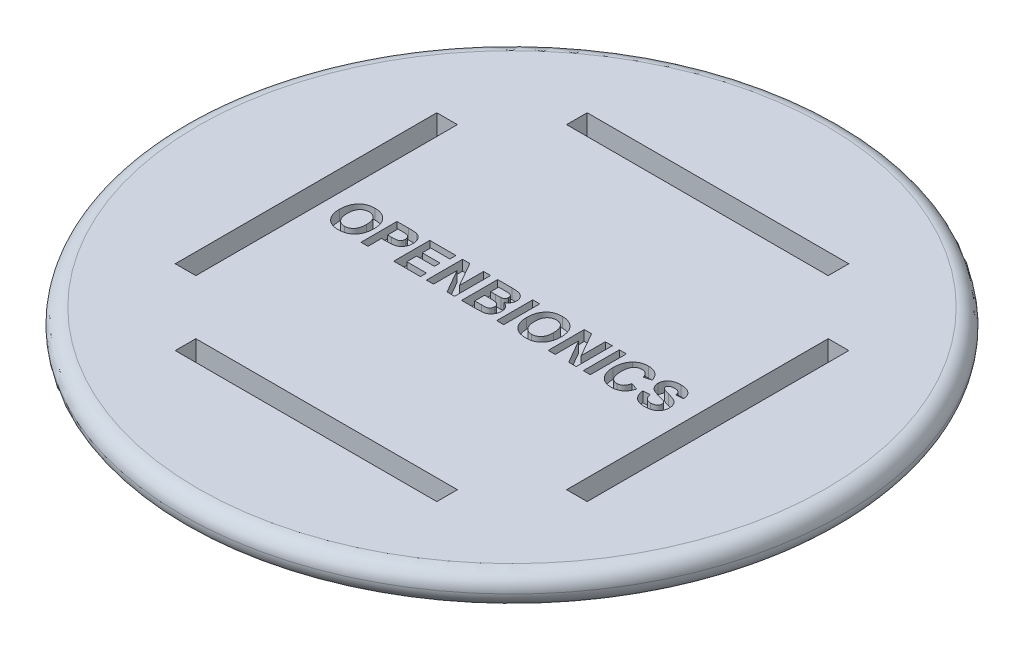
from build123d import *

# Parameters (mm, degrees)
SKETCH1_R           = 32
BOSS_EXTRUDE1_DEPTH = 3
FILLET1_R           = 1.5
SKETCH2_W           = 0.681818182
SKETCH2_H           = 3.5
CUT_EXTRUDE16_DEPTH = 1


with BuildPart() as part:
    # Sketch1 → Boss-Extrude1 (new body)
    with BuildSketch(Plane(origin=(0, 0, 0), x_dir=(1, 0, 0), z_dir=(0, 1, 0))):
        with Locations(Location((0, 0, 0), (0, 0, 270))):
            Circle(SKETCH1_R)
        Polygon((20, 0), (20, -12.7), (18, -12.7), (18, 0), (18, 12.7), (20, 12.7), align=None, mode=Mode.SUBTRACT)
        Polygon((0, -20), (12.7, -20), (12.7, -18), (-12.7, -18), (-12.7, -20), align=None, mode=Mode.SUBTRACT)
        Polygon((-12.7, 20), (0, 20), (12.7, 20), (12.7, 18), (-12.7, 18), align=None, mode=Mode.SUBTRACT)
        Polygon((-18, 0), (-18, 12.7), (-20, 12.7), (-20, -12.7), (-18, -12.7), align=None, mode=Mode.SUBTRACT)
    extrude(amount=BOSS_EXTRUDE1_DEPTH)

    # Fillet1
    fillet1_edges = [part.edges().sort_by_distance(p)[0] for p in [
        (0, 0, -32),
        (0, 3, -32),
    ]]
    fillet(fillet1_edges, radius=FILLET1_R - 0.0001)  # a hair under: the kernel refuses the full size

    # Sketch2 → Cut-Extrude16 (cut)
    # profile 1 of 11: a face of its own
    with BuildSketch(Plane(origin=(0, 3, 0), x_dir=(1, 0, 0), z_dir=(0, 1, 0))):
        with BuildLine():
            add(Edge.make_bspline(
                [(-16.609645699, -0.147233293), (-16.608905442, -0.096557718), (-16.607458053, 0.002525829), (-16.597871271, 0.14770248), (-16.579789771, 0.285848282), (-16.555875636, 0.4172445), (-16.525617713, 0.541945853), (-16.487813812, 0.659647477), (-16.44331312, 0.770682466), (-16.391155277, 0.874620577), (-16.333301907, 0.971543838), (-16.272697263, 1.063159211), (-16.205953939, 1.147073138), (-16.13585696, 1.225232361), (-16.061728351, 1.297289554), (-15.983608008, 1.363234515), (-15.899944986, 1.42097439), (-15.813127545, 1.474277192), (-15.72129319, 1.520264746), (-15.62484703, 1.56012091), (-15.524058793, 1.594220167), (-15.418469302, 1.622021844), (-15.30806541, 1.643034191), (-15.193109273, 1.658689683), (-15.073346632, 1.668122408), (-14.992001856, 1.669053604), (-14.95055479, 1.669528071)],
                knots=[0, 0, 0, 0, 1.306822469, 2.555167917, 3.749327779, 4.897664792, 5.997815556, 7.055828301, 8.082935779, 9.0794699, 10.051102117, 10.992536892, 11.909768373, 12.813243673, 13.698297478, 14.573761109, 15.446004583, 16.317114982, 17.19898365, 18.091251206, 19.006346915, 19.940728156, 20.904561385, 21.902646417, 22.93134929, 24, 24, 24, 24], degree=3))
            add(Edge.make_bspline(
                [(-14.95055479, 1.669528071), (-14.890582564, 1.66831117), (-14.773291827, 1.665931215), (-14.601723326, 1.642966704), (-14.438589976, 1.607474787), (-14.283900163, 1.555868008), (-14.137827669, 1.489581569), (-14.000055675, 1.409150439), (-13.871255158, 1.313627239), (-13.751395843, 1.20456106), (-13.642489911, 1.082015619), (-13.5481512, 0.945726117), (-13.468334758, 0.79732096), (-13.403659805, 0.636170011), (-13.353404262, 0.462911848), (-13.317656035, 0.27748728), (-13.295025272, 0.079889433), (-13.292673468, -0.056023364), (-13.291463881, -0.125926475)],
                knots=[0, 0, 0, 0, 1.040908293, 2.035757388, 3.000252588, 3.93627331, 4.861707544, 5.781132162, 6.701209106, 7.641166776, 8.590615097, 9.541717432, 10.512900712, 11.510675978, 12.551430012, 13.640672608, 14.78654308, 16, 16, 16, 16], degree=3))
            add(Edge.make_bspline(
                [(-13.291463881, -0.125926475), (-13.292959516, -0.196535874), (-13.295878597, -0.334346616), (-13.318708686, -0.53518747), (-13.356929207, -0.724140158), (-13.409926404, -0.901358442), (-13.479110907, -1.066673975), (-13.564088439, -1.219841549), (-13.663295569, -1.362152004), (-13.741652399, -1.44616013), (-13.780810472, -1.488142384)],
                knots=[0, 0, 0, 0, 1.14004733, 2.225068784, 3.25899939, 4.249525742, 5.207352596, 6.146814289, 7.073888242, 8, 8, 8, 8], degree=3))
            add(Edge.make_bspline(
                [(-13.780810472, -1.488142384), (-13.817442716, -1.522911297), (-13.89052404, -1.592275275), (-14.014020638, -1.679958657), (-14.145821332, -1.755315884), (-14.287886244, -1.815603701), (-14.439090396, -1.863388675), (-14.600109572, -1.897279676), (-14.770840267, -1.917185032), (-14.887764501, -1.919958836), (-14.947713881, -1.92138102)],
                knots=[0, 0, 0, 0, 0.946839478, 1.888944702, 2.834083416, 3.791455867, 4.779314375, 5.805853593, 6.875017511, 8, 8, 8, 8], degree=3))
            add(Edge.make_bspline(
                [(-14.947713881, -1.92138102), (-15.008151737, -1.920369051), (-15.125850386, -1.918398308), (-15.297313928, -1.896842161), (-15.45931786, -1.864023454), (-15.611743002, -1.817339102), (-15.754363543, -1.756591298), (-15.886728679, -1.682270075), (-16.010760362, -1.595883946), (-16.083696645, -1.526981742), (-16.120299108, -1.492403748)],
                knots=[0, 0, 0, 0, 1.130604799, 2.201776614, 3.228943634, 4.221246958, 5.18008189, 6.12432893, 7.058710182, 8, 8, 8, 8], degree=3))
            add(Edge.make_bspline(
                [(-16.120299108, -1.492403748), (-16.159399545, -1.450378792), (-16.237377905, -1.366568037), (-16.337051435, -1.225606985), (-16.42200233, -1.07380512), (-16.490901903, -0.91029523), (-16.544235862, -0.735555474), (-16.58232865, -0.54963702), (-16.605250774, -0.352115688), (-16.608156404, -0.216661181), (-16.609645699, -0.147233293)],
                knots=[0, 0, 0, 0, 0.936372132, 1.867415515, 2.810529029, 3.771844382, 4.758555217, 5.788795039, 6.866635801, 8, 8, 8, 8], degree=3))
        make_face()
        with BuildLine():
            add(Edge.make_bspline(
                [(-15.882372972, -0.123795793), (-15.881641901, -0.172599695), (-15.880226747, -0.26707082), (-15.866896338, -0.403912282), (-15.847208219, -0.531656075), (-15.816982513, -0.649810306), (-15.779913059, -0.759050011), (-15.733453528, -0.858584396), (-15.67868626, -0.948847957), (-15.615139957, -1.029150985), (-15.545666147, -1.099846976), (-15.472044384, -1.16168351), (-15.394301004, -1.213604642), (-15.312927286, -1.256904823), (-15.226931579, -1.289573222), (-15.136926539, -1.312995227), (-15.042881306, -1.327553491), (-14.978779259, -1.329490358), (-14.946293426, -1.330471929)],
                knots=[0, 0, 0, 0, 1.361421762, 2.635343484, 3.833243152, 4.964401266, 6.034049828, 7.04772755, 8.023209814, 8.973424148, 9.898364399, 10.784781028, 11.651407134, 12.502433558, 13.351406345, 14.211841733, 15.09379164, 16, 16, 16, 16], degree=3))
            add(Edge.make_bspline(
                [(-14.946293426, -1.330471929), (-14.913581362, -1.329419897), (-14.84929761, -1.327352508), (-14.754891878, -1.31391941), (-14.664913303, -1.290293028), (-14.579200905, -1.25740225), (-14.497547477, -1.215610179), (-14.421451735, -1.162707275), (-14.348329639, -1.102264927), (-14.28009068, -1.031847385), (-14.218149516, -0.951611736), (-14.164542328, -0.860889656), (-14.119109364, -0.760389861), (-14.082549686, -0.64956139), (-14.05339287, -0.529167563), (-14.033178156, -0.398750556), (-14.021170678, -0.258492322), (-14.019565442, -0.16169924), (-14.018736608, -0.111721929)],
                knots=[0, 0, 0, 0, 0.908145916, 1.784632924, 2.640675726, 3.485314444, 4.328955329, 5.180267109, 6.052901625, 6.959238294, 7.896525459, 8.860238814, 9.877929898, 10.952438517, 12.095379492, 13.313121954, 14.612680409, 16, 16, 16, 16], degree=3))
            add(Edge.make_bspline(
                [(-14.018736608, -0.111721929), (-14.019561859, -0.062691067), (-14.021163172, 0.032448151), (-14.033240822, 0.170070932), (-14.05292108, 0.297781816), (-14.080141262, 0.415605543), (-14.116609514, 0.52346823), (-14.160245175, 0.621801042), (-14.212266764, 0.710334665), (-14.273190985, 0.787931911), (-14.340071496, 0.856035555), (-14.411727129, 0.915864753), (-14.488661175, 0.966415529), (-14.570536271, 1.007897656), (-14.657716609, 1.039304271), (-14.749392791, 1.061624987), (-14.846127882, 1.076749172), (-14.91237948, 1.077985902), (-14.946293426, 1.07861898)],
                knots=[0, 0, 0, 0, 1.375936073, 2.669858809, 3.873641008, 5.000148955, 6.059108832, 7.064301869, 8.014637772, 8.933034729, 9.825740232, 10.689210757, 11.547964789, 12.403732021, 13.259189679, 14.142274399, 15.049037189, 16, 16, 16, 16], degree=3))
            add(Edge.make_bspline(
                [(-14.946293426, 1.07861898), (-14.980207704, 1.07798687), (-15.04645995, 1.076752032), (-15.143190397, 1.061614283), (-15.235395077, 1.039218514), (-15.32298637, 1.007371542), (-15.405474535, 0.965542642), (-15.483251684, 0.914995555), (-15.556009462, 0.854823271), (-15.623652902, 0.785793161), (-15.685422278, 0.707209287), (-15.738620691, 0.617879791), (-15.783227634, 0.518645119), (-15.819576844, 0.40938079), (-15.847393508, 0.290212554), (-15.868024932, 0.161129742), (-15.87993733, 0.022024837), (-15.881542181, -0.074056743), (-15.882372972, -0.123795793)],
                knots=[0, 0, 0, 0, 0.942220191, 1.840646711, 2.715612845, 3.577830925, 4.425730711, 5.28209839, 6.151972775, 7.045780727, 7.964974726, 8.924626984, 9.929287112, 10.984750631, 12.121637807, 13.328386914, 14.616972206, 16, 16, 16, 16], degree=3))
        make_face(mode=Mode.SUBTRACT)
    # profile 2 of 11: a face of its own
    with BuildSketch(Plane(origin=(0, 3, 0), x_dir=(1, 0, 0), z_dir=(0, 1, 0))):
        with BuildLine():
            Line((-12.791463881, -1.875926475), (-12.791463881, 1.624073525))
            Line((-12.791463881, 1.624073525), (-11.674986608, 1.624073525))
            add(Edge.make_bspline(
                [(-11.674986608, 1.624073525), (-11.625270457, 1.623928421), (-11.530331219, 1.623651327), (-11.394651558, 1.621822544), (-11.272481968, 1.617453942), (-11.163793541, 1.611934839), (-11.068331871, 1.605005738), (-10.986394248, 1.596552324), (-10.917648534, 1.587555927), (-10.877111129, 1.57795302), (-10.858935472, 1.573647389)],
                knots=[0, 0, 0, 0, 1.456831097, 2.782002075, 3.975928354, 5.038771763, 5.970943127, 6.77995415, 7.452971009, 8, 8, 8, 8], degree=3))
            add(Edge.make_bspline(
                [(-10.858935472, 1.573647389), (-10.83396381, 1.566183483), (-10.784345205, 1.551352729), (-10.712283119, 1.523048973), (-10.643979953, 1.488004172), (-10.578994674, 1.447201832), (-10.517122794, 1.401026172), (-10.45843676, 1.348965754), (-10.404124747, 1.290483869), (-10.352637657, 1.227215844), (-10.305934495, 1.158765886), (-10.265169456, 1.085114752), (-10.230979455, 1.006624692), (-10.203495535, 0.923063697), (-10.181385626, 0.835039583), (-10.165906536, 0.742184651), (-10.156479366, 0.644631361), (-10.155566906, 0.577930698), (-10.155100245, 0.543817843)],
                knots=[0, 0, 0, 0, 0.927373544, 1.842688003, 2.750838682, 3.655582389, 4.570625339, 5.495661043, 6.443441331, 7.408001735, 8.396552612, 9.388437323, 10.39967321, 11.438816708, 12.515770506, 13.626698151, 14.786217429, 16, 16, 16, 16], degree=3))
            add(Edge.make_bspline(
                [(-10.155100245, 0.543817843), (-10.155693572, 0.512789484), (-10.156859485, 0.451817496), (-10.16460466, 0.36233939), (-10.178028121, 0.276633615), (-10.1972975, 0.19505333), (-10.22128637, 0.117018241), (-10.251435876, 0.043119255), (-10.285903991, -0.027541807), (-10.326671303, -0.09347469), (-10.371297658, -0.154818284), (-10.418445904, -0.212018639), (-10.467730605, -0.26484138), (-10.521211534, -0.311679396), (-10.575976652, -0.355443725), (-10.634916974, -0.392958139), (-10.695797985, -0.426379705), (-10.760624312, -0.455796309), (-10.832980381, -0.480171442), (-10.915567837, -0.501312008), (-11.01004225, -0.518688511), (-11.116048513, -0.532515952), (-11.233546954, -0.543762964), (-11.362619044, -0.552225525), (-11.503545927, -0.557164457), (-11.601355637, -0.557546058), (-11.652259335, -0.557744657)],
                knots=[0, 0, 0, 0, 1.041929051, 2.047432956, 3.01331119, 3.952415533, 4.860138496, 5.75180984, 6.629982677, 7.497147139, 8.351091857, 9.175590388, 9.985393555, 10.773682479, 11.560888284, 12.337098378, 13.116234203, 13.891955602, 14.724122277, 15.676657873, 16.752518699, 17.947684938, 19.265579772, 20.715612603, 22.290686436, 24, 24, 24, 24], degree=3))
            Line((-11.652259335, -0.557744657), (-12.109645699, -0.557744657))
            Line((-12.109645699, -0.557744657), (-12.109645699, -1.875926475))
            Line((-12.109645699, -1.875926475), (-12.791463881, -1.875926475))
        make_face()
        with BuildLine():
            Line((-12.109645699, 1.033164434), (-12.109645699, 0.033164434))
            Line((-12.109645699, 0.033164434), (-11.725412745, 0.033164434))
            add(Edge.make_bspline(
                [(-11.725412745, 0.033164434), (-11.694398142, 0.033288322), (-11.634965167, 0.033525727), (-11.549721025, 0.035649966), (-11.472281288, 0.039095952), (-11.402646175, 0.043976675), (-11.340796147, 0.050205331), (-11.286530592, 0.057993325), (-11.23993845, 0.066772338), (-11.188520738, 0.080945946), (-11.132070764, 0.10422609), (-11.071650781, 0.14201605), (-11.016956227, 0.187796848), (-10.969233422, 0.242714029), (-10.929968336, 0.305764881), (-10.902124247, 0.376494756), (-10.885498968, 0.453797942), (-10.883438686, 0.507511106), (-10.882372972, 0.535295116)],
                knots=[0, 0, 0, 0, 1.322620714, 2.534524919, 3.636151256, 4.628084681, 5.511128162, 6.286423077, 6.965565192, 7.531394371, 8.5588625, 9.556278385, 10.559400822, 11.589890268, 12.646170356, 13.711052099, 14.816004388, 16, 16, 16, 16], degree=3))
            add(Edge.make_bspline(
                [(-10.882372972, 0.535295116), (-10.883398372, 0.563553773), (-10.885383336, 0.618256731), (-10.902585194, 0.69692744), (-10.93208544, 0.768116165), (-10.972241735, 0.831581408), (-11.020343596, 0.886692474), (-11.074603072, 0.933098313), (-11.135354968, 0.967945758), (-11.190720168, 0.990028193), (-11.24156165, 1.003270619), (-11.28969355, 1.01038336), (-11.347003666, 1.017401792), (-11.413747128, 1.024023973), (-11.489820613, 1.027873679), (-11.575305158, 1.030505534), (-11.670239697, 1.032860162), (-11.736774716, 1.033059937), (-11.771577517, 1.033164434)],
                knots=[0, 0, 0, 0, 1.157153208, 2.240011081, 3.27962838, 4.299823827, 5.303789601, 6.267767994, 7.211266943, 8.160733058, 8.701966372, 9.360708122, 10.152542664, 11.068708535, 12.10846164, 13.27335753, 14.573761651, 16, 16, 16, 16], degree=3))
            Line((-11.771577517, 1.033164434), (-12.109645699, 1.033164434))
        make_face(mode=Mode.SUBTRACT)
    # profile 3 of 11: a face of its own
    with BuildSketch(Plane(origin=(0, 3, 0), x_dir=(1, 0, 0), z_dir=(0, 1, 0))):
        Polygon((-9.609645699, -1.875926475), (-9.609645699, 1.624073525), (-7.064191154, 1.624073525), (-7.064191154, 1.033164434), (-8.927827517, 1.033164434), (-8.927827517, 0.214982616), (-7.20055479, 0.214982616), (-7.20055479, -0.330471929), (-8.927827517, -0.330471929), (-8.927827517, -1.285017384), (-7.018736608, -1.285017384), (-7.018736608, -1.875926475), align=None)
    # profile 4 of 11: a face of its own
    with BuildSketch(Plane(origin=(0, 3, 0), x_dir=(1, 0, 0), z_dir=(0, 1, 0))):
        Polygon((-6.427827517, -1.875926475), (-6.427827517, 1.624073525), (-5.719020699, 1.624073525), (-4.382372972, -0.713284429), (-4.382372972, 1.624073525), (-3.70055479, 1.624073525), (-3.70055479, -1.875926475), (-4.431378654, -1.875926475), (-5.746009335, 0.40674398), (-5.746009335, -1.875926475), align=None)
    # profile 5 of 11: a face of its own
    with BuildSketch(Plane(origin=(0, 3, 0), x_dir=(1, 0, 0), z_dir=(0, 1, 0))):
        with BuildLine():
            Line((-3.018736608, 1.624073525), (-1.635213881, 1.624073525))
            add(Edge.make_bspline(
                [(-1.635213881, 1.624073525), (-1.589758688, 1.623729728), (-1.502385048, 1.623068883), (-1.376361734, 1.620042063), (-1.260814828, 1.612687408), (-1.155902157, 1.603571548), (-1.061427784, 1.592862669), (-0.97766271, 1.577564015), (-0.903846336, 1.561390549), (-0.820186294, 1.534716517), (-0.726043327, 1.491953202), (-0.623562838, 1.424288818), (-0.529999332, 1.340597464), (-0.46144603, 1.25874357), (-0.41238907, 1.187107345), (-0.37937461, 1.131201536), (-0.352528527, 1.072724714), (-0.330663143, 1.012767022), (-0.31222324, 0.951527668), (-0.300838053, 0.887879502), (-0.292259279, 0.822696555), (-0.291730329, 0.778459369), (-0.291463881, 0.756175798)],
                knots=[0, 0, 0, 0, 1.49832573, 2.880070805, 4.154409333, 5.313752829, 6.351335186, 7.286599284, 8.119477371, 8.840095269, 10.177568719, 11.512946243, 12.872522965, 14.301283232, 15.019870262, 15.733226805, 16.438470663, 17.137165269, 17.836034155, 18.543088877, 19.266111019, 20, 20, 20, 20], degree=3))
            add(Edge.make_bspline(
                [(-0.291463881, 0.756175798), (-0.29303147, 0.715547293), (-0.296125566, 0.635355033), (-0.322863465, 0.518606395), (-0.364840341, 0.407437483), (-0.424743555, 0.304530341), (-0.497670625, 0.211348561), (-0.58086557, 0.128949851), (-0.674913778, 0.059950211), (-0.744496657, 0.025554643), (-0.779390017, 0.00830648)],
                knots=[0, 0, 0, 0, 1.031745329, 2.036451773, 3.029042389, 4.042847881, 5.050578496, 6.029479831, 7.011853638, 8, 8, 8, 8], degree=3))
            add(Edge.make_bspline(
                [(-0.779390017, 0.00830648), (-0.755592066, 0.000359217), (-0.708552837, -0.01534941), (-0.641053037, -0.044485945), (-0.577750063, -0.078261424), (-0.517522691, -0.114817702), (-0.462327447, -0.157000901), (-0.41102978, -0.202781065), (-0.36274135, -0.25172807), (-0.320129193, -0.305878059), (-0.280414041, -0.36245891), (-0.24729803, -0.423227107), (-0.218791779, -0.486615002), (-0.194994532, -0.55298918), (-0.177579389, -0.622771312), (-0.16481016, -0.695393545), (-0.156822417, -0.770873389), (-0.155680458, -0.822166372), (-0.155100245, -0.848227611)],
                knots=[0, 0, 0, 0, 1.053917501, 2.08318216, 3.084375989, 4.067115349, 5.039987852, 5.998256831, 6.954975631, 7.924383767, 8.890110205, 9.856297623, 10.826929889, 11.808561028, 12.814635272, 13.844956918, 14.905053061, 16, 16, 16, 16], degree=3))
            add(Edge.make_bspline(
                [(-0.155100245, -0.848227611), (-0.155817345, -0.879975945), (-0.157223043, -0.942210689), (-0.1672424, -1.033693462), (-0.184266468, -1.121371837), (-0.208242983, -1.205384906), (-0.239925525, -1.285269397), (-0.277494028, -1.36179653), (-0.3225811, -1.434298284), (-0.373490765, -1.502890014), (-0.429043714, -1.566121847), (-0.487842744, -1.623403577), (-0.548531258, -1.674680755), (-0.61247557, -1.718990948), (-0.67842188, -1.757388048), (-0.746893523, -1.789816805), (-0.818261041, -1.814595899), (-0.867116851, -1.826590362), (-0.891605926, -1.832602611)],
                knots=[0, 0, 0, 0, 1.145888616, 2.246230761, 3.317144413, 4.366532562, 5.394832395, 6.415219096, 7.439712572, 8.472016965, 9.495369341, 10.474337565, 11.432801564, 12.359698508, 13.278683255, 14.184703617, 15.090078953, 16, 16, 16, 16], degree=3))
            add(Edge.make_bspline(
                [(-0.891605926, -1.832602611), (-0.911703641, -1.836081283), (-0.95741132, -1.843992731), (-1.035132414, -1.853032924), (-1.1299636, -1.859295466), (-1.241908411, -1.866247228), (-1.371001842, -1.869688222), (-1.517296329, -1.87356931), (-1.68066346, -1.875539479), (-1.795251499, -1.875793284), (-1.855384335, -1.875926475)],
                knots=[0, 0, 0, 0, 0.506837559, 1.152686718, 1.943271314, 2.868501158, 3.939884368, 5.152247396, 6.505573166, 8, 8, 8, 8], degree=3))
            Line((-1.855384335, -1.875926475), (-3.018736608, -1.875926475))
            Line((-3.018736608, -1.875926475), (-3.018736608, 1.624073525))
        make_face()
        with BuildLine():
            Line((-2.336918426, 1.033164434), (-2.336918426, 0.260437161))
            Line((-2.336918426, 0.260437161), (-1.87242979, 0.260437161))
            add(Edge.make_bspline(
                [(-1.87242979, 0.260437161), (-1.839285417, 0.260356326), (-1.776310169, 0.260202737), (-1.686825037, 0.261228576), (-1.607269439, 0.261540146), (-1.537678338, 0.263311828), (-1.478229389, 0.264262952), (-1.428775371, 0.266773833), (-1.389174769, 0.268341333), (-1.366030854, 0.270761679), (-1.356094563, 0.271800798)],
                knots=[0, 0, 0, 0, 1.539755574, 2.925579234, 4.157432792, 5.235486124, 6.159601295, 6.919197766, 7.535983151, 8, 8, 8, 8], degree=3))
            add(Edge.make_bspline(
                [(-1.356094563, 0.271800798), (-1.327531043, 0.276512928), (-1.272871592, 0.28553011), (-1.19629745, 0.310208737), (-1.130209844, 0.34544501), (-1.073343646, 0.389104374), (-1.027962846, 0.442622652), (-0.996160839, 0.505943221), (-0.976487726, 0.577451159), (-0.974379351, 0.628200957), (-0.973282063, 0.654613298)],
                knots=[0, 0, 0, 0, 1.155953593, 2.21204495, 3.198187972, 4.134992194, 5.061661754, 5.975590643, 6.946411786, 8, 8, 8, 8], degree=3))
            add(Edge.make_bspline(
                [(-0.973282063, 0.654613298), (-0.974068299, 0.678387595), (-0.975573586, 0.723904676), (-0.991746247, 0.788720172), (-1.018122234, 0.846432735), (-1.054819594, 0.896242742), (-1.098227186, 0.937912648), (-1.146246989, 0.972263085), (-1.199678062, 0.996418897), (-1.249225281, 1.009811033), (-1.297201989, 1.01723495), (-1.347320804, 1.020646485), (-1.41094956, 1.025461116), (-1.488438677, 1.027441817), (-1.579552648, 1.030967663), (-1.684460207, 1.03158165), (-1.803057627, 1.033635087), (-1.886633025, 1.033326845), (-1.930668426, 1.033164434)],
                knots=[0, 0, 0, 0, 0.973232962, 1.863303131, 2.719035475, 3.559878583, 4.383792702, 5.178355008, 5.968992937, 6.774511991, 7.275703832, 7.957795842, 8.833506946, 9.892453685, 11.135757626, 12.572757575, 14.19420548, 16, 16, 16, 16], degree=3))
            Line((-1.930668426, 1.033164434), (-2.336918426, 1.033164434))
        make_face(mode=Mode.SUBTRACT)
        with BuildLine():
            Line((-2.336918426, -0.330471929), (-2.336918426, -1.285017384))
            Line((-2.336918426, -1.285017384), (-1.70055479, -1.285017384))
            add(Edge.make_bspline(
                [(-1.70055479, -1.285017384), (-1.667174066, -1.284821568), (-1.603487336, -1.284447972), (-1.512796666, -1.283279541), (-1.431576523, -1.280456273), (-1.359797122, -1.276430087), (-1.297311078, -1.270580056), (-1.243912361, -1.264647421), (-1.200049409, -1.256956594), (-1.15398278, -1.245905851), (-1.10474536, -1.225694444), (-1.052233156, -1.192108328), (-1.003754675, -1.150529618), (-0.961636674, -1.09923148), (-0.925436155, -1.040179752), (-0.899989965, -0.97252846), (-0.884923326, -0.897425399), (-0.883246113, -0.844986849), (-0.882372972, -0.817687839)],
                knots=[0, 0, 0, 0, 1.469198961, 2.803069115, 3.991633206, 5.045866989, 5.966571943, 6.753647565, 7.409750792, 7.925283571, 8.836625382, 9.735673484, 10.659027785, 11.63558286, 12.645208211, 13.694021469, 14.799529522, 16, 16, 16, 16], degree=3))
            add(Edge.make_bspline(
                [(-0.882372972, -0.817687839), (-0.88352668, -0.789689661), (-0.885745985, -0.735831588), (-0.900936007, -0.658454712), (-0.929176932, -0.589467272), (-0.967294973, -0.528572958), (-1.013513746, -0.475371668), (-1.068375487, -0.432008476), (-1.129577843, -0.396331899), (-1.187475895, -0.374987888), (-1.240934903, -0.361947829), (-1.290864974, -0.354001262), (-1.349751966, -0.345773334), (-1.418328367, -0.340888712), (-1.495935834, -0.335380156), (-1.58312645, -0.333255921), (-1.679470354, -0.330741329), (-1.746953815, -0.330564413), (-1.782230926, -0.330471929)],
                knots=[0, 0, 0, 0, 1.143415858, 2.199506562, 3.201276226, 4.169695553, 5.121909749, 6.064058807, 7.012585, 8.003802762, 8.571244154, 9.257860184, 10.067301576, 10.998624703, 12.064230723, 13.244332689, 14.559469531, 16, 16, 16, 16], degree=3))
            Line((-1.782230926, -0.330471929), (-2.336918426, -0.330471929))
        make_face(mode=Mode.SUBTRACT)
    # profile 6 of 11: a face of its own
    with BuildSketch(Plane(origin=(0, 3, 0), x_dir=(1, 0, 0), z_dir=(0, 1, 0))):
        with Locations((0.731263392, -0.125926475)):
            Rectangle(SKETCH2_W, SKETCH2_H)
    # profile 7 of 11: a face of its own
    with BuildSketch(Plane(origin=(0, 3, 0), x_dir=(1, 0, 0), z_dir=(0, 1, 0))):
        with BuildLine():
            add(Edge.make_bspline(
                [(1.572172483, -0.147233293), (1.572912739, -0.096557718), (1.574360128, 0.002525829), (1.583946911, 0.14770248), (1.602028411, 0.285848282), (1.625942546, 0.4172445), (1.656200469, 0.541945853), (1.69400437, 0.659647477), (1.738505062, 0.770682466), (1.790662905, 0.874620577), (1.848516275, 0.971543838), (1.909120918, 1.063159211), (1.975864242, 1.147073138), (2.045961222, 1.225232361), (2.120089831, 1.297289554), (2.198210174, 1.363234515), (2.281873196, 1.42097439), (2.368690637, 1.474277192), (2.460524992, 1.520264746), (2.556971152, 1.56012091), (2.657759389, 1.594220167), (2.76334888, 1.622021844), (2.873752772, 1.643034191), (2.988708909, 1.658689683), (3.10847155, 1.668122408), (3.189816326, 1.669053604), (3.231263392, 1.669528071)],
                knots=[0, 0, 0, 0, 1.306822469, 2.555167917, 3.749327779, 4.897664792, 5.997815556, 7.055828301, 8.082935779, 9.0794699, 10.051102117, 10.992536892, 11.909768373, 12.813243673, 13.698297478, 14.573761109, 15.446004583, 16.317114982, 17.19898365, 18.091251206, 19.006346915, 19.940728156, 20.904561385, 21.902646417, 22.93134929, 24, 24, 24, 24], degree=3))
            add(Edge.make_bspline(
                [(3.231263392, 1.669528071), (3.291235617, 1.66831117), (3.408526355, 1.665931215), (3.580094855, 1.642966704), (3.743228206, 1.607474787), (3.897918018, 1.555868008), (4.043990513, 1.489581569), (4.181762507, 1.409150439), (4.310563024, 1.313627239), (4.430422339, 1.20456106), (4.539328271, 1.082015619), (4.633666981, 0.945726117), (4.713483424, 0.79732096), (4.778158376, 0.636170011), (4.82841392, 0.462911848), (4.864162147, 0.27748728), (4.88679291, 0.079889433), (4.889144714, -0.056023364), (4.890354301, -0.125926475)],
                knots=[0, 0, 0, 0, 1.040908293, 2.035757388, 3.000252588, 3.93627331, 4.861707544, 5.781132162, 6.701209106, 7.641166776, 8.590615097, 9.541717432, 10.512900712, 11.510675978, 12.551430012, 13.640672608, 14.78654308, 16, 16, 16, 16], degree=3))
            add(Edge.make_bspline(
                [(4.890354301, -0.125926475), (4.888858666, -0.196535874), (4.885939585, -0.334346616), (4.863109495, -0.53518747), (4.824888975, -0.724140158), (4.771891778, -0.901358442), (4.702707275, -1.066673975), (4.617729743, -1.219841549), (4.518522613, -1.362152004), (4.440165783, -1.44616013), (4.40100771, -1.488142384)],
                knots=[0, 0, 0, 0, 1.14004733, 2.225068784, 3.25899939, 4.249525742, 5.207352596, 6.146814289, 7.073888242, 8, 8, 8, 8], degree=3))
            add(Edge.make_bspline(
                [(4.40100771, -1.488142384), (4.364375466, -1.522911297), (4.291294142, -1.592275275), (4.167797544, -1.679958657), (4.03599685, -1.755315884), (3.893931937, -1.815603701), (3.742727786, -1.863388675), (3.581708609, -1.897279676), (3.410977915, -1.917185032), (3.294053681, -1.919958836), (3.234104301, -1.92138102)],
                knots=[0, 0, 0, 0, 0.946839478, 1.888944702, 2.834083416, 3.791455867, 4.779314375, 5.805853593, 6.875017511, 8, 8, 8, 8], degree=3))
            add(Edge.make_bspline(
                [(3.234104301, -1.92138102), (3.173666445, -1.920369051), (3.055967796, -1.918398308), (2.884504254, -1.896842161), (2.722500322, -1.864023454), (2.57007518, -1.817339102), (2.427454638, -1.756591298), (2.295089503, -1.682270075), (2.17105782, -1.595883946), (2.098121537, -1.526981742), (2.061519074, -1.492403748)],
                knots=[0, 0, 0, 0, 1.130604799, 2.201776614, 3.228943634, 4.221246958, 5.18008189, 6.12432893, 7.058710182, 8, 8, 8, 8], degree=3))
            add(Edge.make_bspline(
                [(2.061519074, -1.492403748), (2.022418636, -1.450378792), (1.944440277, -1.366568037), (1.844766747, -1.225606985), (1.759815852, -1.07380512), (1.690916278, -0.91029523), (1.637582319, -0.735555474), (1.599489531, -0.54963702), (1.576567408, -0.352115688), (1.573661778, -0.216661181), (1.572172483, -0.147233293)],
                knots=[0, 0, 0, 0, 0.936372132, 1.867415515, 2.810529029, 3.771844382, 4.758555217, 5.788795039, 6.866635801, 8, 8, 8, 8], degree=3))
        make_face()
        with BuildLine():
            add(Edge.make_bspline(
                [(2.29944521, -0.123795793), (2.30017628, -0.172599695), (2.301591435, -0.26707082), (2.314921843, -0.403912282), (2.334609963, -0.531656075), (2.364835669, -0.649810306), (2.401905123, -0.759050011), (2.448364654, -0.858584396), (2.503131922, -0.948847957), (2.566678225, -1.029150985), (2.636152035, -1.099846976), (2.709773797, -1.16168351), (2.787517178, -1.213604642), (2.868890896, -1.256904823), (2.954886603, -1.289573222), (3.044891643, -1.312995227), (3.138936876, -1.327553491), (3.203038923, -1.329490358), (3.235524755, -1.330471929)],
                knots=[0, 0, 0, 0, 1.361421762, 2.635343484, 3.833243152, 4.964401266, 6.034049828, 7.04772755, 8.023209814, 8.973424148, 9.898364399, 10.784781028, 11.651407134, 12.502433558, 13.351406345, 14.211841733, 15.09379164, 16, 16, 16, 16], degree=3))
            add(Edge.make_bspline(
                [(3.235524755, -1.330471929), (3.26823682, -1.329419897), (3.332520571, -1.327352508), (3.426926304, -1.31391941), (3.516904879, -1.290293028), (3.602617276, -1.25740225), (3.684270705, -1.215610179), (3.760366447, -1.162707275), (3.833488543, -1.102264927), (3.901727502, -1.031847385), (3.963668666, -0.951611736), (4.017275854, -0.860889656), (4.062708817, -0.760389861), (4.099268496, -0.64956139), (4.128425312, -0.529167563), (4.148640026, -0.398750556), (4.160647504, -0.258492322), (4.16225274, -0.16169924), (4.163081574, -0.111721929)],
                knots=[0, 0, 0, 0, 0.908145916, 1.784632924, 2.640675726, 3.485314444, 4.328955329, 5.180267109, 6.052901625, 6.959238294, 7.896525459, 8.860238814, 9.877929898, 10.952438517, 12.095379492, 13.313121954, 14.612680409, 16, 16, 16, 16], degree=3))
            add(Edge.make_bspline(
                [(4.163081574, -0.111721929), (4.162256323, -0.062691067), (4.16065501, 0.032448151), (4.14857736, 0.170070932), (4.128897101, 0.297781816), (4.10167692, 0.415605543), (4.065208668, 0.52346823), (4.021573007, 0.621801042), (3.969551418, 0.710334665), (3.908627197, 0.787931911), (3.841746686, 0.856035555), (3.770091053, 0.915864753), (3.693157007, 0.966415529), (3.611281911, 1.007897656), (3.524101573, 1.039304271), (3.432425391, 1.061624987), (3.3356903, 1.076749172), (3.269438702, 1.077985902), (3.235524755, 1.07861898)],
                knots=[0, 0, 0, 0, 1.375936073, 2.669858809, 3.873641008, 5.000148955, 6.059108832, 7.064301869, 8.014637772, 8.933034729, 9.825740232, 10.689210757, 11.547964789, 12.403732021, 13.259189679, 14.142274399, 15.049037189, 16, 16, 16, 16], degree=3))
            add(Edge.make_bspline(
                [(3.235524755, 1.07861898), (3.201610478, 1.07798687), (3.135358232, 1.076752032), (3.038627785, 1.061614283), (2.946423105, 1.039218514), (2.858831811, 1.007371542), (2.776343647, 0.965542642), (2.698566498, 0.914995555), (2.62580872, 0.854823271), (2.558165279, 0.785793161), (2.496395904, 0.707209287), (2.443197491, 0.617879791), (2.398590548, 0.518645119), (2.362241338, 0.40938079), (2.334424674, 0.290212554), (2.313793249, 0.161129742), (2.301880851, 0.022024837), (2.300276001, -0.074056743), (2.29944521, -0.123795793)],
                knots=[0, 0, 0, 0, 0.942220191, 1.840646711, 2.715612845, 3.577830925, 4.425730711, 5.28209839, 6.151972775, 7.045780727, 7.964974726, 8.924626984, 9.929287112, 10.984750631, 12.121637807, 13.328386914, 14.616972206, 16, 16, 16, 16], degree=3))
        make_face(mode=Mode.SUBTRACT)
    # profile 8 of 11: a face of its own
    with BuildSketch(Plane(origin=(0, 3, 0), x_dir=(1, 0, 0), z_dir=(0, 1, 0))):
        Polygon((5.390354301, -1.875926475), (5.390354301, 1.624073525), (6.099161119, 1.624073525), (7.435808846, -0.713284429), (7.435808846, 1.624073525), (8.117627028, 1.624073525), (8.117627028, -1.875926475), (7.386803165, -1.875926475), (6.072172483, 0.40674398), (6.072172483, -1.875926475), align=None)
    # profile 9 of 11: a face of its own
    with BuildSketch(Plane(origin=(0, 3, 0), x_dir=(1, 0, 0), z_dir=(0, 1, 0))):
        with Locations((9.140354301, -0.125926475)):
            Rectangle(SKETCH2_W, SKETCH2_H)
    # profile 10 of 11: a face of its own
    with BuildSketch(Plane(origin=(0, 3, 0), x_dir=(1, 0, 0), z_dir=(0, 1, 0))):
        with BuildLine():
            Line((12.253990665, -0.603199202), (12.935808846, -0.830471929))
            add(Edge.make_bspline(
                [(12.935808846, -0.830471929), (12.922529317, -0.87639033), (12.896565411, -0.966169198), (12.847007078, -1.093770247), (12.792723767, -1.212335699), (12.731200914, -1.321158934), (12.663293012, -1.420734207), (12.588465351, -1.510488395), (12.50768387, -1.591011324), (12.420064433, -1.661360986), (12.32638321, -1.722362914), (12.228257551, -1.776036588), (12.124487919, -1.820793267), (12.015781145, -1.857880323), (11.901642208, -1.886006811), (11.782555323, -1.906795996), (11.658121192, -1.918823248), (11.573381664, -1.920518522), (11.530269074, -1.92138102)],
                knots=[0, 0, 0, 0, 1.183334218, 2.313634703, 3.386574538, 4.410574965, 5.4059049, 6.367593416, 7.300465351, 8.226252946, 9.145088672, 10.066017336, 10.992992505, 11.94049116, 12.907509409, 13.901352976, 14.932279751, 16, 16, 16, 16], degree=3))
            add(Edge.make_bspline(
                [(11.530269074, -1.92138102), (11.476215346, -1.920359459), (11.370533558, -1.918362179), (11.216089742, -1.896676005), (11.069179658, -1.863877175), (10.930039422, -1.816961982), (10.798924298, -1.756016376), (10.675933123, -1.681907776), (10.559837391, -1.594876361), (10.490706409, -1.52685366), (10.45569521, -1.492403748)],
                knots=[0, 0, 0, 0, 1.089030095, 2.129189823, 3.137637474, 4.120182689, 5.083210505, 6.04660488, 7.010708328, 8, 8, 8, 8], degree=3))
            add(Edge.make_bspline(
                [(10.45569521, -1.492403748), (10.417460804, -1.450172327), (10.341237316, -1.365980455), (10.245753183, -1.224074807), (10.163151509, -1.072907267), (10.09674639, -0.910276189), (10.044479931, -0.737177886), (10.00830994, -0.553029413), (9.984711415, -0.358310846), (9.982429337, -0.22471975), (9.981263392, -0.156466248)],
                knots=[0, 0, 0, 0, 0.939378199, 1.87272906, 2.815321204, 3.779152946, 4.767034002, 5.795628841, 6.873756891, 8, 8, 8, 8], degree=3))
            add(Edge.make_bspline(
                [(9.981263392, -0.156466248), (9.982825285, -0.084444686), (9.985869335, 0.055921682), (10.007715202, 0.260567377), (10.045532145, 0.452911616), (10.096793604, 0.633771481), (10.164723332, 0.802425851), (10.247294547, 0.958954218), (10.343682579, 1.104652157), (10.420737121, 1.190529811), (10.459246346, 1.233448525)],
                knots=[0, 0, 0, 0, 1.147239906, 2.235912344, 3.273608702, 4.26668403, 5.22612696, 6.164093732, 7.082476833, 8, 8, 8, 8], degree=3))
            add(Edge.make_bspline(
                [(10.459246346, 1.233448525), (10.494736305, 1.268357653), (10.565191796, 1.337660067), (10.68349148, 1.426831922), (10.811033402, 1.501638946), (10.946993525, 1.563861468), (11.09219884, 1.611239728), (11.245788104, 1.645504344), (11.408539707, 1.665298175), (11.520035465, 1.668095347), (11.577144074, 1.669528071)],
                knots=[0, 0, 0, 0, 0.966767503, 1.919249325, 2.870162763, 3.835889464, 4.819515192, 5.833151023, 6.89013061, 8, 8, 8, 8], degree=3))
            add(Edge.make_bspline(
                [(11.577144074, 1.669528071), (11.623819262, 1.668588101), (11.715521353, 1.666741357), (11.850288751, 1.651751521), (11.978907106, 1.625983934), (12.102218852, 1.591345589), (12.219427566, 1.545833237), (12.330697748, 1.490216358), (12.436144433, 1.424627462), (12.501125943, 1.37351262), (12.53382021, 1.347795116)],
                knots=[0, 0, 0, 0, 1.086769647, 2.135161167, 3.152581641, 4.138566977, 5.114264243, 6.075825338, 7.031886454, 8, 8, 8, 8], degree=3))
            add(Edge.make_bspline(
                [(12.53382021, 1.347795116), (12.55648593, 1.328103088), (12.602190393, 1.288394949), (12.663882956, 1.220200984), (12.7208938, 1.14519853), (12.77323724, 1.063302205), (12.821860644, 0.975009529), (12.865057681, 0.879480778), (12.903366364, 0.777098032), (12.924845163, 0.705880499), (12.935808846, 0.669528071)],
                knots=[0, 0, 0, 0, 0.89952434, 1.813852658, 2.750795336, 3.721437255, 4.725224391, 5.770248276, 6.861840827, 8, 8, 8, 8], degree=3))
            Line((12.935808846, 0.669528071), (12.253990665, 0.487709889))
            add(Edge.make_bspline(
                [(12.253990665, 0.487709889), (12.248463728, 0.511020025), (12.237683266, 0.556487173), (12.215195456, 0.621691092), (12.189036939, 0.682685187), (12.159151797, 0.739701541), (12.125607255, 0.792991825), (12.087475359, 0.841734083), (12.04494965, 0.885958256), (11.999848997, 0.926765358), (11.950543556, 0.961894859), (11.899633241, 0.99321074), (11.846558153, 1.020007177), (11.790933737, 1.040977573), (11.733349198, 1.058320547), (11.673427481, 1.070252673), (11.611420945, 1.077596611), (11.569352384, 1.078275036), (11.548024755, 1.07861898)],
                knots=[0, 0, 0, 0, 1.146431136, 2.236149739, 3.297374424, 4.321569966, 5.315265457, 6.3084436, 7.278585356, 8.250050635, 9.215944931, 10.172414991, 11.110232009, 12.057523199, 13.015134432, 13.986599711, 14.979260236, 16, 16, 16, 16], degree=3))
            add(Edge.make_bspline(
                [(11.548024755, 1.07861898), (11.517920758, 1.077794907), (11.458617464, 1.076171526), (11.371760851, 1.063531305), (11.289455618, 1.040799961), (11.210756739, 1.01164746), (11.137155144, 0.97153553), (11.066920675, 0.924306054), (11.002592049, 0.866317406), (10.940575425, 0.802088898), (10.885436296, 0.72652443), (10.837962395, 0.639755538), (10.797352594, 0.54192965), (10.765490488, 0.432424939), (10.738714049, 0.31250651), (10.722112714, 0.180778267), (10.710103709, 0.038358895), (10.70907054, -0.060556543), (10.708536119, -0.111721929)],
                knots=[0, 0, 0, 0, 0.876000539, 1.725675013, 2.546303326, 3.357564691, 4.16206861, 4.980002579, 5.81482545, 6.677502011, 7.574626286, 8.527584821, 9.549948596, 10.650725717, 11.842708212, 13.122108504, 14.511370591, 16, 16, 16, 16], degree=3))
            add(Edge.make_bspline(
                [(10.708536119, -0.111721929), (10.709168986, -0.164769934), (10.710388077, -0.266956276), (10.721020001, -0.414464986), (10.738723753, -0.55006837), (10.76199512, -0.674293679), (10.794251733, -0.786021182), (10.831868208, -0.88653706), (10.878457605, -0.974472199), (10.931135749, -1.051290413), (10.990259826, -1.117156018), (11.053313884, -1.174169796), (11.12097983, -1.222162953), (11.192081458, -1.262421925), (11.268002021, -1.293249787), (11.348305047, -1.31403999), (11.432455945, -1.328409084), (11.490197081, -1.329775667), (11.519615665, -1.330471929)],
                knots=[0, 0, 0, 0, 1.53787595, 2.962409635, 4.284579308, 5.501468767, 6.622478013, 7.652415205, 8.607298926, 9.500253693, 10.346146662, 11.167541168, 11.959857722, 12.746535154, 13.531683978, 14.327530593, 15.147892042, 16, 16, 16, 16], degree=3))
            add(Edge.make_bspline(
                [(11.519615665, -1.330471929), (11.541179465, -1.329864426), (11.58397311, -1.328658827), (11.64703157, -1.320929096), (11.707916069, -1.307344201), (11.766453746, -1.288104381), (11.82250297, -1.263181615), (11.876445114, -1.232942091), (11.92801108, -1.197521551), (11.977643382, -1.156844627), (12.02385514, -1.109549938), (12.067299066, -1.056186729), (12.107115391, -0.996182941), (12.14319424, -0.929668475), (12.176509776, -0.85734325), (12.206470295, -0.778598186), (12.232714177, -0.693402981), (12.246765589, -0.633830627), (12.253990665, -0.603199202)],
                knots=[0, 0, 0, 0, 0.91694982, 1.81969891, 2.696480544, 3.565542193, 4.435361448, 5.300683673, 6.191397453, 7.092348683, 8.02485971, 8.998050327, 10.014333494, 11.082063102, 12.212624682, 13.397927453, 14.662043956, 16, 16, 16, 16], degree=3))
        make_face()
    # profile 11 of 11: a face of its own
    with BuildSketch(Plane(origin=(0, 3, 0), x_dir=(1, 0, 0), z_dir=(0, 1, 0))):
        with BuildLine():
            Line((13.390354301, -0.694108293), (14.072172483, -0.648653748))
            add(Edge.make_bspline(
                [(14.072172483, -0.648653748), (14.07708075, -0.676175605), (14.086657271, -0.729873498), (14.105658462, -0.807342656), (14.129148093, -0.879518736), (14.156730138, -0.946242199), (14.188197644, -1.007684072), (14.222738671, -1.064203504), (14.262190956, -1.115026541), (14.3054393, -1.160273994), (14.352198748, -1.200948828), (14.403301103, -1.235593175), (14.458468608, -1.264690539), (14.517025205, -1.289286047), (14.579810028, -1.307311466), (14.646240581, -1.321092439), (14.716645369, -1.328708162), (14.764863933, -1.329875472), (14.789502028, -1.330471929)],
                knots=[0, 0, 0, 0, 1.222363655, 2.38495366, 3.485012746, 4.538637656, 5.538767545, 6.501213104, 7.431031534, 8.346385564, 9.234640133, 10.136308501, 11.039461587, 11.958496796, 12.908500038, 13.891223754, 14.922484894, 16, 16, 16, 16], degree=3))
            add(Edge.make_bspline(
                [(14.789502028, -1.330471929), (14.813902432, -1.330087002), (14.861606567, -1.329334448), (14.931116408, -1.322777609), (14.996788863, -1.312584094), (15.057895944, -1.296611937), (15.115226159, -1.277495613), (15.168863546, -1.254378634), (15.217822742, -1.225392533), (15.263421958, -1.193887729), (15.303732911, -1.158423906), (15.338786654, -1.120454195), (15.368985489, -1.080731415), (15.393185913, -1.038333085), (15.412522563, -0.994364536), (15.42629638, -0.948116827), (15.433995191, -0.899860763), (15.435200738, -0.866956193), (15.435808846, -0.850358293)],
                knots=[0, 0, 0, 0, 1.300968024, 2.54346424, 3.720338761, 4.841087788, 5.907093593, 6.94160654, 7.948556664, 8.936328074, 9.893613432, 10.80491921, 11.688697445, 12.548430866, 13.402210641, 14.245092252, 15.114780037, 16, 16, 16, 16], degree=3))
            add(Edge.make_bspline(
                [(15.435808846, -0.850358293), (15.435315582, -0.83109937), (15.434354896, -0.793590493), (15.421403626, -0.739881737), (15.402806695, -0.689896139), (15.373946184, -0.645242985), (15.338221532, -0.604362402), (15.293927051, -0.567795609), (15.241670277, -0.535342128), (15.191136785, -0.510886001), (15.142010205, -0.491324825), (15.092775898, -0.47580104), (15.033033356, -0.455832006), (14.961327994, -0.436214161), (14.878709647, -0.412176057), (14.784705938, -0.38685228), (14.679170606, -0.360102128), (14.605311251, -0.341145689), (14.566490665, -0.331182157)],
                knots=[0, 0, 0, 0, 0.840963089, 1.637868418, 2.40567573, 3.164691736, 3.950401636, 4.774337329, 5.668462709, 6.637068896, 7.227824366, 7.981516369, 8.89583039, 9.984735266, 11.234484658, 12.66229779, 14.245698785, 16, 16, 16, 16], degree=3))
            add(Edge.make_bspline(
                [(14.566490665, -0.331182157), (14.531161321, -0.32214875), (14.462653906, -0.304631999), (14.364279773, -0.275988156), (14.272770893, -0.248082684), (14.18924025, -0.217801776), (14.112053035, -0.188549571), (14.042848202, -0.157177836), (13.980533349, -0.126063084), (13.907845199, -0.083790443), (13.82686983, -0.024398847), (13.740091377, 0.056252221), (13.66443741, 0.147467475), (13.598989965, 0.247234127), (13.54674897, 0.354646812), (13.508449149, 0.467142438), (13.486067152, 0.58388898), (13.482872412, 0.663043059), (13.481263392, 0.702908752)],
                knots=[0, 0, 0, 0, 1.069300604, 2.073489422, 3.00452721, 3.874104024, 4.678611025, 5.424419073, 6.101281212, 6.720461262, 7.888330875, 9.037750688, 10.186226591, 11.355086309, 12.528781361, 13.679207157, 14.831140282, 16, 16, 16, 16], degree=3))
            add(Edge.make_bspline(
                [(13.481263392, 0.702908752), (13.483220084, 0.748984086), (13.487071029, 0.839664437), (13.51632508, 0.97226822), (13.564893074, 1.097588097), (13.63303664, 1.214303528), (13.717222596, 1.320998275), (13.817826988, 1.4141108), (13.933075988, 1.492873731), (14.039825094, 1.546410684), (14.132273889, 1.581687825), (14.206277357, 1.60510264), (14.284255863, 1.625147263), (14.366337006, 1.641232313), (14.45237314, 1.653929909), (14.542159047, 1.663385309), (14.636045607, 1.667962634), (14.700009736, 1.668998785), (14.732683846, 1.669528071)],
                knots=[0, 0, 0, 0, 1.242582616, 2.445512994, 3.644926745, 4.855719552, 6.078920409, 7.299432413, 8.539845382, 9.834070669, 10.511517714, 11.208561922, 11.927511148, 12.682997909, 13.464506909, 14.273724814, 15.118185356, 16, 16, 16, 16], degree=3))
            add(Edge.make_bspline(
                [(14.732683846, 1.669528071), (14.781244589, 1.668750144), (14.875938004, 1.667233189), (15.014063974, 1.654284445), (15.143863228, 1.633138629), (15.265719845, 1.604382314), (15.379070799, 1.565880128), (15.484333415, 1.518961595), (15.582030684, 1.464451504), (15.66992008, 1.399928368), (15.75020752, 1.329115405), (15.820173254, 1.249953978), (15.879377859, 1.163019196), (15.929460636, 1.069571014), (15.969443099, 0.96852864), (15.998952197, 0.860132914), (16.019213158, 0.744546432), (16.024176249, 0.664874806), (16.026717937, 0.624073525)],
                knots=[0, 0, 0, 0, 1.24315921, 2.424159642, 3.548238367, 4.608255284, 5.626116126, 6.608393896, 7.555730331, 8.484480713, 9.394608644, 10.292154726, 11.181578983, 12.081904486, 13.001530639, 13.957419463, 14.953957569, 16, 16, 16, 16], degree=3))
            Line((16.026717937, 0.624073525), (15.344899755, 0.57861898))
            add(Edge.make_bspline(
                [(15.344899755, 0.57861898), (15.34097739, 0.600945525), (15.333367038, 0.644264499), (15.316727084, 0.706084616), (15.297862595, 0.76292927), (15.275796031, 0.814623293), (15.250463821, 0.861059939), (15.220962739, 0.901729055), (15.188923285, 0.937830164), (15.140807771, 0.979046247), (15.069407006, 1.020124084), (14.970508448, 1.05475351), (14.85612326, 1.074944553), (14.774908423, 1.077348249), (14.731973619, 1.07861898)],
                knots=[0, 0, 0, 0, 0.920083089, 1.785186845, 2.596883244, 3.350482143, 4.064794536, 4.739792979, 5.386471749, 6.020449498, 7.304807975, 8.703556819, 10.257311765, 12, 12, 12, 12], degree=3))
            add(Edge.make_bspline(
                [(14.731973619, 1.07861898), (14.689048889, 1.077731268), (14.607756707, 1.076050093), (14.493717292, 1.05832909), (14.394544952, 1.030124146), (14.312253435, 0.98885827), (14.246559708, 0.939368), (14.198208677, 0.88285092), (14.168354816, 0.818952103), (14.164836566, 0.773751451), (14.163081574, 0.751204207)],
                knots=[0, 0, 0, 0, 1.41891023, 2.687176087, 3.807127569, 4.815829045, 5.714967832, 6.510139362, 7.25681932, 8, 8, 8, 8], degree=3))
            add(Edge.make_bspline(
                [(14.163081574, 0.751204207), (14.16450283, 0.728954863), (14.167307899, 0.685042327), (14.192449552, 0.622752675), (14.232727715, 0.566325768), (14.269055151, 0.536172866), (14.288081574, 0.520380343)],
                knots=[0, 0, 0, 0, 0.976730231, 1.927728756, 2.914652001, 4, 4, 4, 4], degree=3))
            add(Edge.make_bspline(
                [(14.288081574, 0.520380343), (14.300216875, 0.512034896), (14.327027541, 0.493597199), (14.37596492, 0.470108886), (14.435335622, 0.444516014), (14.506540628, 0.41892565), (14.588351672, 0.3905577), (14.682119099, 0.363862659), (14.786766631, 0.334115071), (14.860703173, 0.315619003), (14.899587255, 0.305891707)],
                knots=[0, 0, 0, 0, 0.542459979, 1.198463279, 1.996401546, 2.927370469, 3.987627511, 5.189397503, 6.52187166, 8, 8, 8, 8], degree=3))
            add(Edge.make_bspline(
                [(14.899587255, 0.305891707), (14.941058554, 0.295157787), (15.021126962, 0.274433868), (15.1365516, 0.241851922), (15.243028433, 0.208393534), (15.340896962, 0.175194877), (15.429988767, 0.14218169), (15.509621035, 0.107783588), (15.580918849, 0.074257615), (15.662535594, 0.028196589), (15.752789735, -0.034426154), (15.849685767, -0.118154891), (15.930614149, -0.214467378), (15.999371782, -0.319919077), (16.05309939, -0.436804181), (16.090261324, -0.56535348), (16.113447602, -0.705110555), (16.116201022, -0.802203966), (16.117627028, -0.852488975)],
                knots=[0, 0, 0, 0, 1.109774234, 2.142635, 3.106722056, 4.000848189, 4.819903157, 5.567250761, 6.247568553, 6.859970054, 7.993023639, 9.088108622, 10.167137396, 11.240608903, 12.341073656, 13.486032982, 14.698007882, 16, 16, 16, 16], degree=3))
            add(Edge.make_bspline(
                [(16.117627028, -0.852488975), (16.116764388, -0.889479398), (16.115064254, -0.962381914), (16.098854496, -1.069205043), (16.073306525, -1.17153041), (16.037685197, -1.269523238), (15.991388537, -1.36300067), (15.933919597, -1.451458896), (15.866669458, -1.53547484), (15.790182921, -1.615584945), (15.702074564, -1.688057881), (15.602086432, -1.751443603), (15.489967356, -1.803262927), (15.366825422, -1.846838928), (15.232465482, -1.880566872), (15.086388992, -1.904561011), (14.928980153, -1.918526825), (14.82007028, -1.920410236), (14.763933846, -1.92138102)],
                knots=[0, 0, 0, 0, 0.910444437, 1.794347976, 2.654097161, 3.504384284, 4.357006899, 5.217368701, 6.096954472, 7.004088633, 7.940212942, 8.899384036, 9.911325973, 10.975338608, 12.112250157, 13.318040622, 14.617612615, 16, 16, 16, 16], degree=3))
            add(Edge.make_bspline(
                [(14.763933846, -1.92138102), (14.713949221, -1.920407904), (14.616611263, -1.918512897), (14.474804551, -1.904361326), (14.341613719, -1.880204022), (14.21661192, -1.847213658), (14.100415343, -1.803634492), (13.992285187, -1.75118587), (13.893185185, -1.688234866), (13.802108334, -1.616218586), (13.720305007, -1.53391164), (13.64638118, -1.442638321), (13.582768234, -1.340758461), (13.526171042, -1.23021807), (13.478952891, -1.109713321), (13.439684549, -0.97987926), (13.410152247, -0.84029961), (13.397068407, -0.743686364), (13.390354301, -0.694108293)],
                knots=[0, 0, 0, 0, 1.163155875, 2.265080849, 3.312258897, 4.310598958, 5.269483325, 6.195957392, 7.102358896, 7.996368184, 8.892412398, 9.797607466, 10.723868542, 11.682372952, 12.683991443, 13.731517285, 14.835905002, 16, 16, 16, 16], degree=3))
        make_face()
    extrude(amount=-CUT_EXTRUDE16_DEPTH, mode=Mode.SUBTRACT)


solid = part.part
